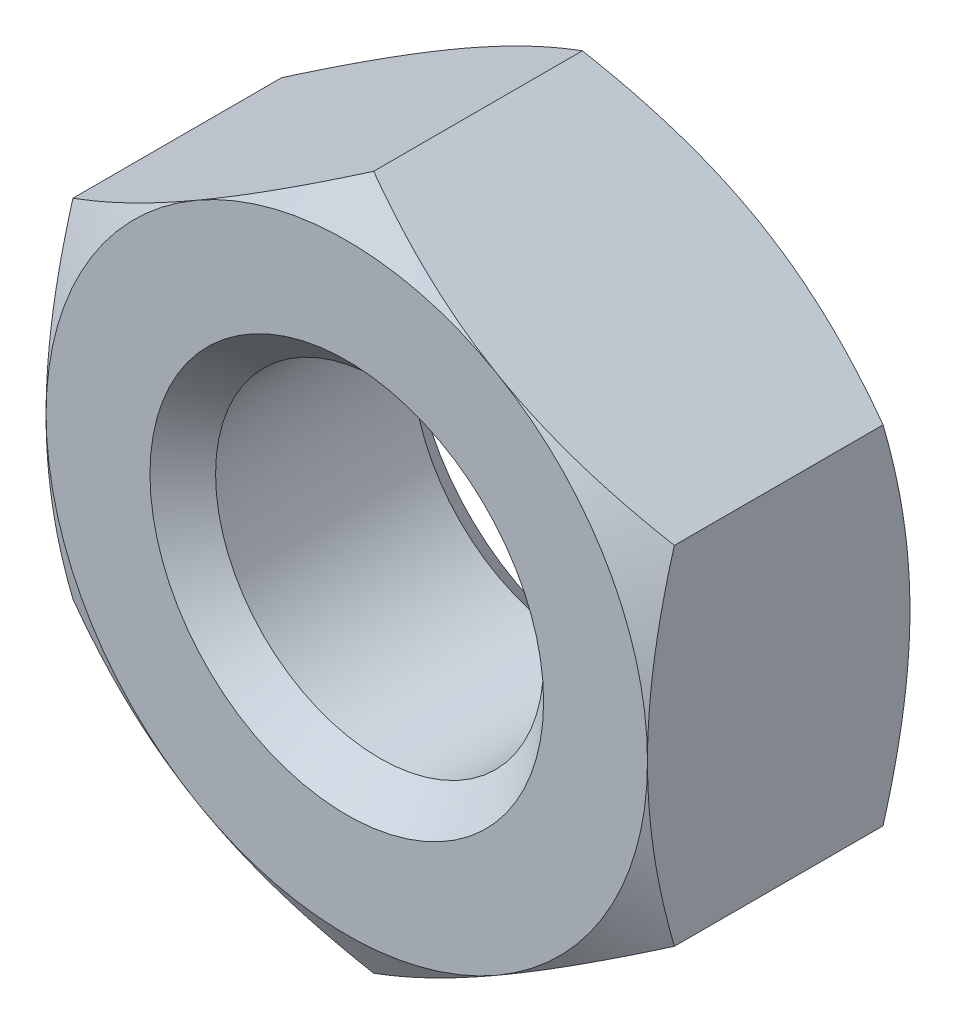
from build123d import *

# Parameters (mm, degrees)
SKETCH1_R           = 3.25
SKETCH1_R_2         = 1.5
BOSS_EXTRUDE1_DEPTH = 2.4
CHAMFER1_SIZE       = 0.5
CHAMFER1_SIZE2      = 0.288675135
CHAMFER2_SIZE       = 0.5
CHAMFER2_SIZE2      = 0.288675135
SKETCH1_3_R         = 3.25
CUT_EXTRUDE1_DEPTH  = 6.185074734
CHAMFER3_SIZE       = 0.3


with BuildPart() as part:
    # Sketch1 → Boss-Extrude1 (new body)
    with BuildSketch(Plane.XY):
        Circle(SKETCH1_R)
        Circle(SKETCH1_R_2, mode=Mode.SUBTRACT)
    extrude(amount=BOSS_EXTRUDE1_DEPTH)

    # Chamfer1
    chamfer1_edges = [part.edges().sort_by_distance(p)[0] for p in [
        (-3.25, 0, 2.4),
    ]]
    chamfer1_side = [part.faces().sort_by_distance(p)[0] for p in [
        (-3.158076118, 0, 2.4),
    ]]
    chamfer(chamfer1_edges, length=CHAMFER1_SIZE, length2=CHAMFER1_SIZE2, reference=chamfer1_side[0])

    # Chamfer2
    chamfer2_edges = [part.edges().sort_by_distance(p)[0] for p in [
        (-3.25, 0, 0),
    ]]
    chamfer2_side = [part.faces().sort_by_distance(p)[0] for p in [
        (-3.158076118, 0, 0),
    ]]
    chamfer(chamfer2_edges, length=CHAMFER2_SIZE, length2=CHAMFER2_SIZE2, reference=chamfer2_side[0])

    # Sketch1<3> → Cut-Extrude1 (cut, through all)
    with BuildSketch(Plane.XY):
        Circle(SKETCH1_3_R)
        Polygon((-2.75, 1.58771324), (0, 3.175426481), (2.75, 1.58771324), (2.75, -1.58771324), (0, -3.175426481), (-2.75, -1.58771324), align=None, mode=Mode.SUBTRACT)
    extrude(amount=CUT_EXTRUDE1_DEPTH, mode=Mode.SUBTRACT)

    # Chamfer3
    chamfer3_edges = [part.edges().sort_by_distance(p)[0] for p in [
        (-1.5, 0, 0),
        (-1.5, 0, 2.4),
    ]]
    chamfer(chamfer3_edges, length=CHAMFER3_SIZE)


solid = part.part
